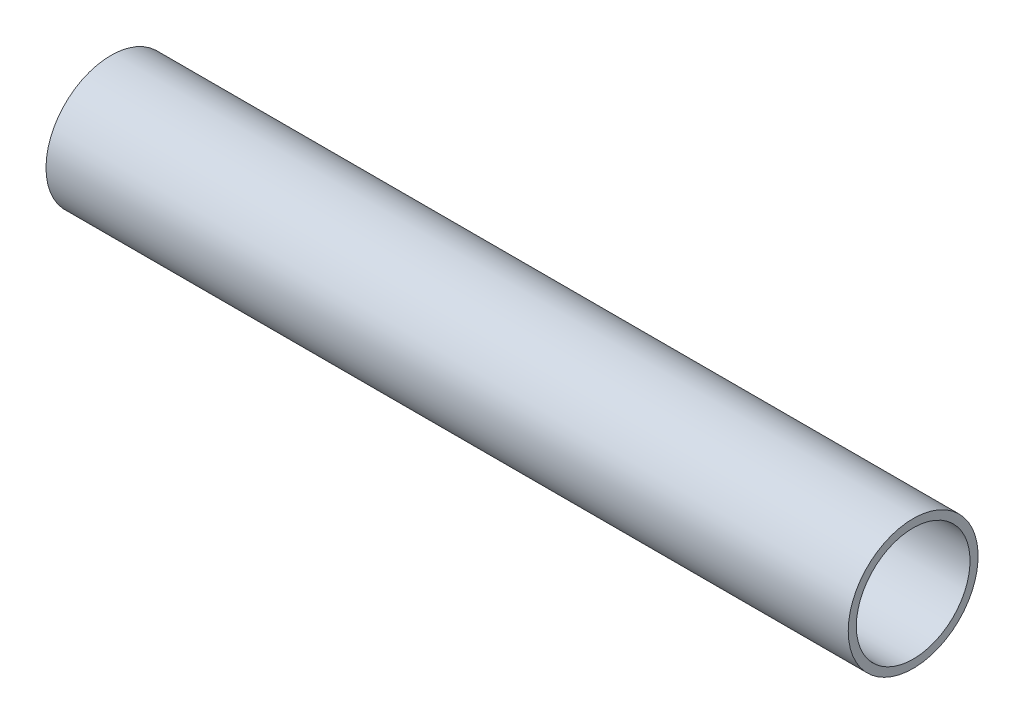
from build123d import *

# Parameters (mm, degrees)
SKETCH2_W = 1999.999999992
SKETCH2_H = 20.193


with BuildPart() as part:
    # Sketch2 → Revolve1 (revolve)
    with BuildSketch(Plane.XY):
        with Locations((999.999999996, 151.8285)):
            Rectangle(SKETCH2_W, SKETCH2_H)
    revolve(axis=Axis((0, 0, 0), (1, 0, 0)))


solid = part.part
